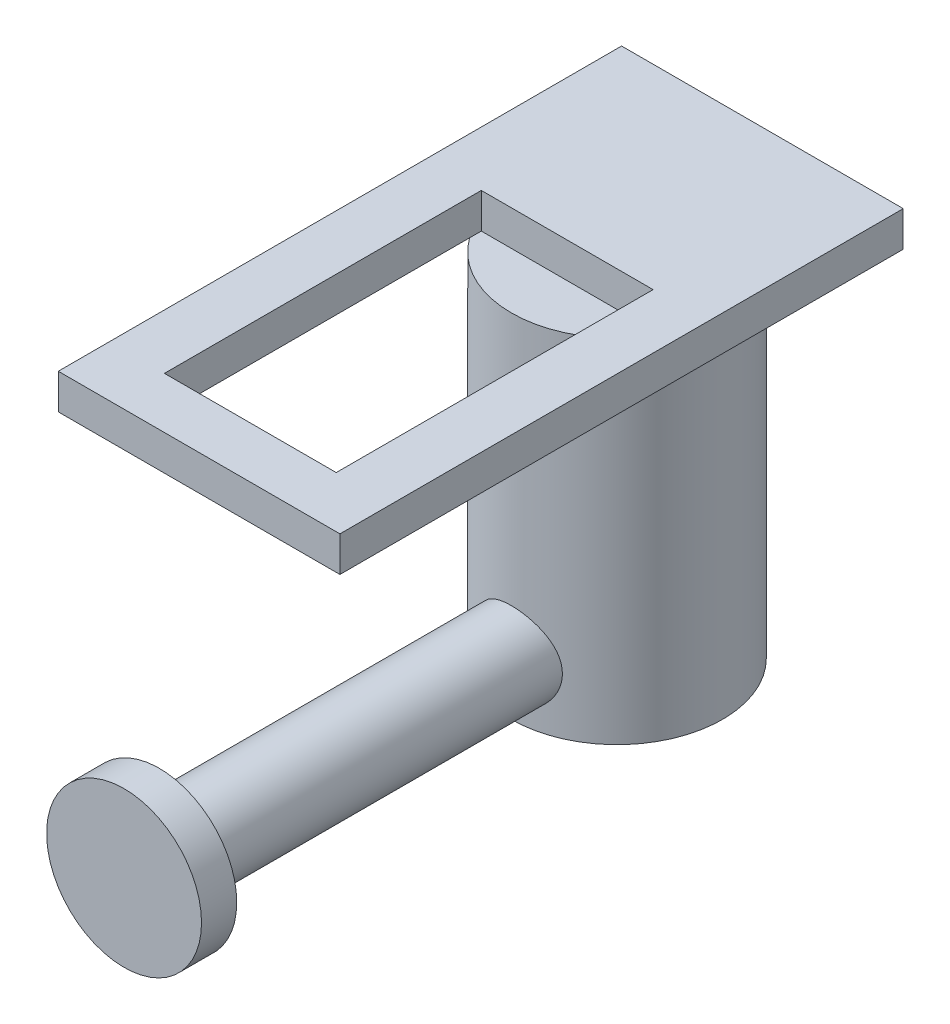
from build123d import *

# Parameters (mm, degrees)
SKETCH1_R                            = 15
BOSS_EXTRUDE1_DEPTH                  = 50
SKETCH2_R                            = 6
BOSS_EXTRUDE2_DEPTH                  = 50
BOSS_EXTRUDE2_DIRECTION_2_REACH      = 62.208
BOSS_EXTRUDE2_DIRECTION_2_END_RADIUS = 15
SKETCH6_R                            = 11
BOSS_EXTRUDE4_DEPTH                  = 5
SKETCH7_W                            = 40
SKETCH7_H                            = 80
SKETCH7_W_2                          = 24.4
SKETCH7_H_2                          = 45
BOSS_EXTRUDE5_DEPTH                  = 5


with BuildPart() as part:
    # Sketch1 → Boss-Extrude1 (new body)
    with BuildSketch(Plane(origin=(0, 0, 0), x_dir=(1, 0, 0), z_dir=(0, 1, 0))):
        Circle(SKETCH1_R)
    extrude(amount=BOSS_EXTRUDE1_DEPTH)

    # Sketch7 → Boss-Extrude5 (add)
    with BuildSketch(Plane(origin=(0, 50, 0), x_dir=(1, 0, 0), z_dir=(0, 1, 0))):
        with Locations((0, -19.344671948)):
            Rectangle(SKETCH7_W, SKETCH7_H)
        with Locations((0, -29.568049779)):
            Rectangle(SKETCH7_W_2, SKETCH7_H_2, mode=Mode.SUBTRACT)
    extrude(amount=BOSS_EXTRUDE5_DEPTH)


with BuildPart() as body_2:
    # Sketch2 → Boss-Extrude2 (new body)
    with BuildSketch(Plane.XY.offset(15)):
        with Locations((0, 8)):
            Circle(SKETCH2_R)
    extrude(amount=BOSS_EXTRUDE2_DEPTH)

    # Boss-Extrude2 direction 2: up to this cylinder (the profile starts outside it)
    boss_extrude2_direction_2_end = Plane(origin=(0, 8, 0), z_dir=(0, -1, 0)) * Cylinder(BOSS_EXTRUDE2_DIRECTION_2_END_RADIUS, 155.416, mode=Mode.PRIVATE)
    # Sketch2 → Boss-Extrude2 direction 2 (add, up to the surface)
    with BuildSketch(Plane.XY.offset(15), mode=Mode.PRIVATE) as boss_extrude2_direction_2_sk1:
        with Locations((0, 8)):
            Circle(SKETCH2_R)
    boss_extrude2_direction_2_tool1 = extrude(boss_extrude2_direction_2_sk1.sketch, amount=-BOSS_EXTRUDE2_DIRECTION_2_REACH, mode=Mode.PRIVATE) - boss_extrude2_direction_2_end
    add(boss_extrude2_direction_2_tool1.solids().sort_by_distance((0, 8, 15))[0])
    add(boss_extrude2_direction_2_tool1.solids().sort_by_distance((0, 8, 15))[1])

    # Sketch6 → Boss-Extrude4 (add)
    with BuildSketch(Plane.XY.offset(65)):
        with Locations((0, 8)):
            Circle(SKETCH6_R)
    extrude(amount=BOSS_EXTRUDE4_DEPTH)


solid = Compound([part.part, body_2.part])
